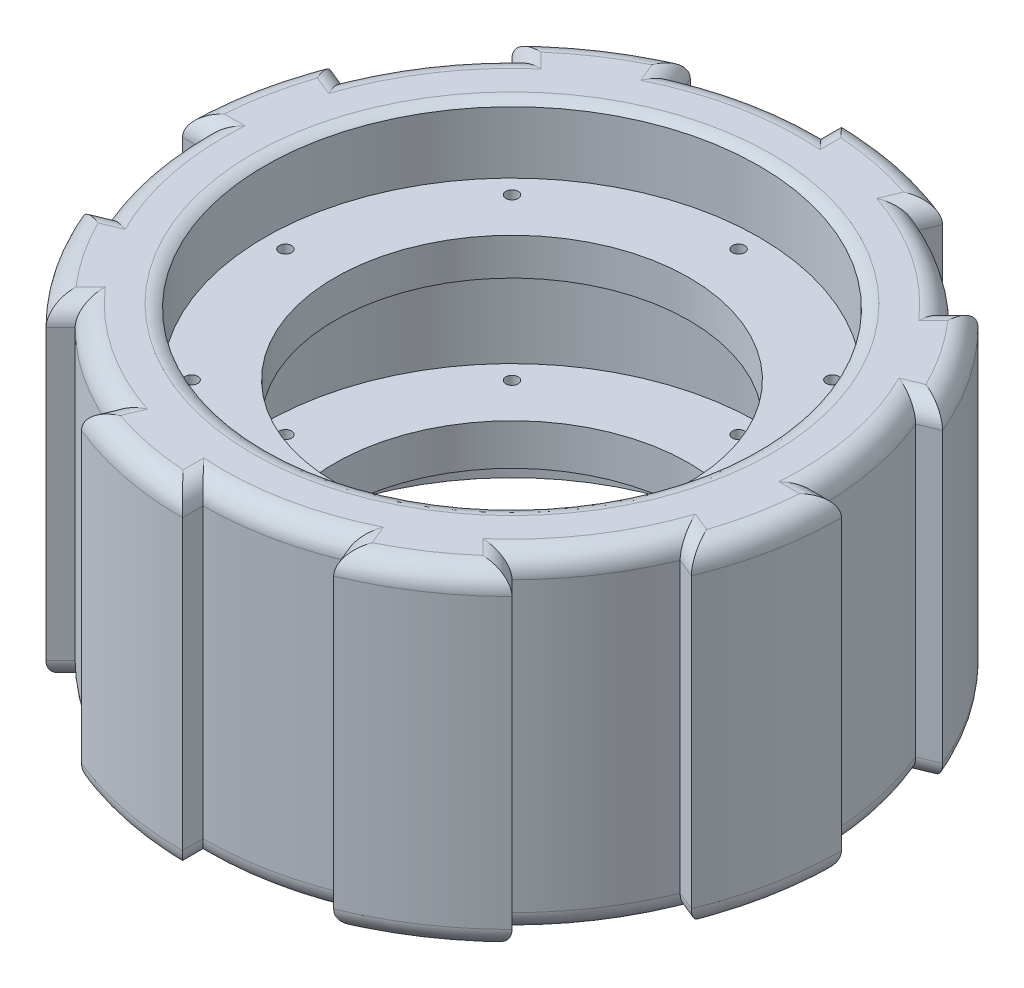
from build123d import *

# Parameters (mm, degrees)
SKETCH1_R                = 58
BOSS_EXTRUDE1_DEPTH      = 80
FILLET4_R                = 5
SKETCH11_R               = 60
CUT_EXTRUDE6_DEPTH       = 10
CUT_EXTRUDE7_START       = -55
SKETCH12_R               = 60
CUT_EXTRUDE7_DEPTH       = 55
BOSS_EXTRUDE7_START      = -25
SKETCH14_R               = 60
SKETCH14_R_2             = 43
BOSS_EXTRUDE7_DEPTH      = 25
CUT_EXTRUDE8_START       = -10
SKETCH15_R               = 60
CUT_EXTRUDE8_DEPTH       = 10
SKETCH17_R               = 60
CUT_INNER_CIRCLE_1_DEPTH = 5
CUT_START                = -5
SKETCH18_R               = 60
CUT_INNER_CIRCLE_2_DEPTH = 5
CUT_EXTRUDE13_DEPTH      = 150
CUT_EXTRUDE13_DEPTH_BACK = 69


# Read off the part's stored shape, not the designer's step: Boss-Extrude6
with BuildPart() as part:
    # Sketch1 → Boss-Extrude1 (new body)
    with BuildSketch(Plane(origin=(0, 0, 0), x_dir=(1, 0, 0), z_dir=(0, 1, 0))):
        with BuildLine():
            Line((-28.701257427, -69.290964938), (-30.603717804, -73.914900098))
            ThreePointArc((-30.603717804, -73.914900098), (-15.601410067, -78.463979022), (0, -80))
            Line((0, -80), (0, -75))
            ThreePointArc((0, -75), (14.631774151, -73.55889603), (28.701257427, -69.290964938))
            Line((28.701257427, -69.290964938), (30.614674589, -73.910362601))
            ThreePointArc((30.614674589, -73.910362601), (44.445618642, -66.517568984), (56.568542495, -56.568542495))
            Line((56.568542495, -56.568542495), (53.033008589, -53.033008589))
            ThreePointArc((53.033008589, -53.033008589), (62.409591507, -41.593784246), (69.358844501, -28.536830404))
            Line((69.358844501, -28.536830404), (73.982767468, -30.439285764))
            ThreePointArc((73.982767468, -30.439285764), (78.481276103, -15.514164537), (80, 0))
            Line((80, 0), (75, 0))
            ThreePointArc((75, 0), (73.55889603, 14.631774151), (69.290964938, 28.701257427))
            Line((69.290964938, 28.701257427), (73.910362601, 30.614674589))
            ThreePointArc((73.910362601, 30.614674589), (66.517568984, 44.445618642), (56.568542495, 56.568542495))
            Line((56.568542495, 56.568542495), (53.033008589, 53.033008589))
            ThreePointArc((53.033008589, 53.033008589), (41.680487796, 62.3517196), (28.729525087, 69.279249334))
            Line((28.729525087, 69.279249334), (30.64482676, 73.897865956))
            ThreePointArc((30.64482676, 73.897865956), (15.623231476, 78.459637), (0, 80))
            Line((0, 80), (0, 75))
            ThreePointArc((0, 75), (-14.631774151, 73.55889603), (-28.701257427, 69.290964938))
            Line((-28.701257427, 69.290964938), (-30.614674589, 73.910362601))
            ThreePointArc((-30.614674589, 73.910362601), (-44.445618642, 66.517568984), (-56.568542495, 56.568542495))
            Line((-56.568542495, 56.568542495), (-53.033008589, 53.033008589))
            ThreePointArc((-53.033008589, 53.033008589), (-62.409591507, 41.593784246), (-69.358844501, 28.536830404))
            Line((-69.358844501, 28.536830404), (-73.982767468, 30.439285764))
            ThreePointArc((-73.982767468, 30.439285764), (-78.481276103, 15.514164537), (-80, 0))
            Line((-80, 0), (-75, 0))
            ThreePointArc((-75, 0), (-73.55889603, -14.631774151), (-69.290964938, -28.701257427))
            Line((-69.290964938, -28.701257427), (-73.910362601, -30.614674589))
            ThreePointArc((-73.910362601, -30.614674589), (-66.517568984, -44.445618642), (-56.568542495, -56.568542495))
            Line((-56.568542495, -56.568542495), (-53.033008589, -53.033008589))
            ThreePointArc((-53.033008589, -53.033008589), (-41.667767476, -62.360220923), (-28.701257427, -69.290964938))
        make_face()
        with Locations(Location((0, 0, 0), (0, 0, 270))):
            Circle(SKETCH1_R, mode=Mode.SUBTRACT)
    extrude(amount=BOSS_EXTRUDE1_DEPTH)

    # Fillet4
    fillet4_edges = [part.edges().sort_by_distance(p)[0] for p in [
        (-71.60066377, 80, 29.657966008),
        (-66.517568984, 80, 44.445618642),
        (-54.800775542, 80, 54.800775542),
        (-41.667767476, 80, 62.360220923),
        (-29.652487616, 80, 71.602932518),
        (-15.601410067, 80, 78.463979022),
        (0, 80, 77.5),
        (14.631774151, 80, 73.55889603),
        (29.657966008, 80, 71.60066377),
        (44.445618642, 80, 66.517568984),
        (54.800775542, 80, 54.800775542),
        (62.409591507, 80, 41.593784246),
        (71.670805984, 80, 29.488058084),
        (78.481276103, 80, 15.514164537),
        (77.5, 80, 0),
        (73.55889603, 80, -14.631774151),
        (71.60066377, 80, -29.657966008),
        (66.517568984, 80, -44.445618642),
        (54.800775542, 80, -54.800775542),
        (41.680487796, 80, -62.3517196),
        (29.687175923, 80, -71.588557645),
        (15.623231476, 80, -78.459637),
        (0, 80, -77.5),
        (15.623231476, 0, -78.459637),
        (29.687175923, 0, -71.588557645),
        (41.680487796, 0, -62.3517196),
        (54.800775542, 0, -54.800775542),
        (66.517568984, 0, -44.445618642),
        (71.60066377, 0, -29.657966008),
        (73.55889603, 0, -14.631774151),
        (77.5, 0, 0),
        (-14.631774151, 80, -73.55889603),
        (78.481276103, 0, 15.514164537),
        (71.670805984, 0, 29.488058084),
        (62.409591507, 0, 41.593784246),
        (54.800775542, 0, 54.800775542),
        (44.445618642, 0, 66.517568984),
        (29.657966008, 0, 71.60066377),
        (14.631774151, 0, 73.55889603),
        (0, 0, 77.5),
        (-15.601410067, 0, 78.463979022),
        (-29.652487616, 0, 71.602932518),
        (-29.657966008, 80, -71.60066377),
        (-41.667767476, 0, 62.360220923),
        (-54.800775542, 0, 54.800775542),
        (-66.517568984, 0, 44.445618642),
        (-71.60066377, 0, 29.657966008),
        (-73.55889603, 0, 14.631774151),
        (-77.5, 0, 0),
        (-78.481276103, 0, -15.514164537),
        (-71.670805984, 0, -29.488058084),
        (-62.409591507, 0, -41.593784246),
        (-54.800775542, 0, -54.800775542),
        (-44.445618642, 0, -66.517568984),
        (-29.657966008, 0, -71.60066377),
        (-44.445618642, 80, -66.517568984),
        (-14.631774151, 0, -73.55889603),
        (0, 80, -58),
        (0, 0, -77.5),
        (0, 0, -58),
        (-54.800775542, 80, -54.800775542),
        (-62.409591507, 80, -41.593784246),
        (-71.670805984, 80, -29.488058084),
        (-78.481276103, 80, -15.514164537),
        (-77.5, 80, 0),
        (-73.55889603, 80, 14.631774151),
    ]]
    fillet(fillet4_edges, radius=FILLET4_R)

    # Boss-Extrude6 outline → Boss-Extrude6 (revolve)
    with BuildSketch(Plane.XY):
        Polygon((43, 0), (60, 0), (60, 5), (58, 5), (58, 75), (60, 75), (60, 79), (43, 79), align=None)
    revolve(axis=Axis((0, 0, 0), (0, 1, 0)))

    # Sketch11 → Cut-Extrude6 (cut)
    with BuildSketch(Plane(origin=(0, 79, 0), x_dir=(1, 0, 0), z_dir=(0, 1, 0))):
        with Locations(Location((0, 0, 0), (0, 0, 270))):
            Circle(SKETCH11_R)
    extrude(amount=-CUT_EXTRUDE6_DEPTH, mode=Mode.SUBTRACT)

    # Sketch12 → Cut-Extrude7 (cut)
    with BuildSketch(Plane.XZ.offset(CUT_EXTRUDE7_START)):
        with Locations(Location((0, 0, 0), (0, 0, 90))):
            Circle(SKETCH12_R)
    extrude(amount=CUT_EXTRUDE7_DEPTH, mode=Mode.SUBTRACT)

    # Sketch14 → Boss-Extrude7 (add)
    with BuildSketch(Plane.XZ.offset(BOSS_EXTRUDE7_START)):
        with Locations(Location((0, 0, 0), (0, 0, 270))):
            Circle(SKETCH14_R)
        with Locations(Location((0, 0, 0), (0, 0, 270))):
            Circle(SKETCH14_R_2, mode=Mode.SUBTRACT)
    extrude(amount=BOSS_EXTRUDE7_DEPTH)

    # Sketch15 → Cut-Extrude8 (cut)
    with BuildSketch(Plane.XZ.offset(CUT_EXTRUDE8_START)):
        with Locations(Location((0, 0, 0), (0, 0, 270))):
            Circle(SKETCH15_R)
    extrude(amount=CUT_EXTRUDE8_DEPTH, mode=Mode.SUBTRACT)

    # Sketch17 → Cut Inner Circle 1 (cut)
    with BuildSketch(Plane(origin=(0, 69, 0), x_dir=(1, 0, 0), z_dir=(0, 1, 0))):
        with Locations(Location((0, 0, 0), (0, 0, 90))):
            Circle(SKETCH17_R)
    extrude(amount=-CUT_INNER_CIRCLE_1_DEPTH, mode=Mode.SUBTRACT)

    # Sketch18 → Cut Inner Circle 2 (cut)
    with BuildSketch(Plane.XZ.offset(-10).offset(CUT_START)):
        with Locations(Location((0, 0, 0), (0, 0, 270))):
            Circle(SKETCH18_R)
    extrude(amount=CUT_INNER_CIRCLE_2_DEPTH, mode=Mode.SUBTRACT)

    # Sketch21 → Cut-Extrude13 (cut, two sides: drawn at the far end of the back side and taken through both)
    with BuildSketch(Plane(origin=(0, 0, 0), x_dir=(1, 0, 0), z_dir=(0, 1, 0)).offset(-CUT_EXTRUDE13_DEPTH_BACK)):
        with BuildLine():
            ThreePointArc((0, 56.5), (-1.5, 55), (0, 53.5))
            Line((0, 53.5), (0, 56.5))
        make_face()
        with BuildLine():
            Line((0, 56.5), (0, 53.5))
            ThreePointArc((0, 53.5), (1.060660172, 53.939339828), (1.5, 55))
            ThreePointArc((1.5, 55), (1.060660172, 56.060660172), (0, 56.5))
        make_face()
        with BuildLine():
            ThreePointArc((-56.5, 0), (-55, -1.5), (-53.5, 0))
            Line((-53.5, 0), (-56.5, 0))
        make_face()
        with BuildLine():
            Line((-56.5, 0), (-53.5, 0))
            ThreePointArc((-53.5, 0), (-55, 1.5), (-56.5, 0))
        make_face()
        with BuildLine():
            ThreePointArc((56.5, 0), (55, 1.5), (53.5, 0))
            Line((53.5, 0), (56.5, 0))
        make_face()
        with BuildLine():
            Line((56.5, 0), (53.5, 0))
            ThreePointArc((53.5, 0), (55, -1.5), (56.5, 0))
        make_face()
        with BuildLine():
            ThreePointArc((1.5, -55), (1.060660172, -53.939339828), (0, -53.5))
            Line((0, -53.5), (0, -56.5))
            ThreePointArc((0, -56.5), (1.060660172, -56.060660172), (1.5, -55))
        make_face()
        with BuildLine():
            Line((0, -56.5), (0, -53.5))
            ThreePointArc((0, -53.5), (-1.5, -55), (0, -56.5))
        make_face()
        with BuildLine():
            ThreePointArc((-37.390872965, -38.890872965), (-37.505053666, -38.316847817), (-37.830212793, -37.830212793))
            Line((-37.830212793, -37.830212793), (-39.951533137, -39.951533137))
            ThreePointArc((-39.951533137, -39.951533137), (-38.316847817, -40.276692264), (-37.390872965, -38.890872965))
        make_face()
        with BuildLine():
            Line((-39.951533137, -39.951533137), (-37.830212793, -37.830212793))
            ThreePointArc((-37.830212793, -37.830212793), (-39.951533137, -37.830212793), (-39.951533137, -39.951533137))
        make_face()
        with BuildLine():
            ThreePointArc((-39.951533137, 39.951533137), (-39.951533137, 37.830212793), (-37.830212793, 37.830212793))
            Line((-37.830212793, 37.830212793), (-39.951533137, 39.951533137))
        make_face()
        with BuildLine():
            Line((-39.951533137, 39.951533137), (-37.830212793, 37.830212793))
            ThreePointArc((-37.830212793, 37.830212793), (-37.505053666, 38.316847817), (-37.390872965, 38.890872965))
            ThreePointArc((-37.390872965, 38.890872965), (-38.316847817, 40.276692264), (-39.951533137, 39.951533137))
        make_face()
        with BuildLine():
            ThreePointArc((39.951533137, 39.951533137), (37.830212793, 39.951533137), (37.830212793, 37.830212793))
            Line((37.830212793, 37.830212793), (39.951533137, 39.951533137))
        make_face()
        with BuildLine():
            Line((39.951533137, 39.951533137), (37.830212793, 37.830212793))
            ThreePointArc((37.830212793, 37.830212793), (39.464898114, 37.505053666), (40.390872965, 38.890872965))
            ThreePointArc((40.390872965, 38.890872965), (40.276692264, 39.464898114), (39.951533137, 39.951533137))
        make_face()
        with BuildLine():
            ThreePointArc((40.090872965, -38.890872965), (39.350093084, -37.782217526), (38.042344828, -38.042344828))
            Line((38.042344828, -38.042344828), (39.739401103, -39.739401103))
            ThreePointArc((39.739401103, -39.739401103), (39.999528404, -39.350093084), (40.090872965, -38.890872965))
        make_face()
        with BuildLine():
            Line((39.739401103, -39.739401103), (38.042344828, -38.042344828))
            ThreePointArc((38.042344828, -38.042344828), (38.042344828, -39.739401103), (39.739401103, -39.739401103))
        make_face()
    extrude(amount=CUT_EXTRUDE13_DEPTH + CUT_EXTRUDE13_DEPTH_BACK, mode=Mode.SUBTRACT)


solid = part.part
